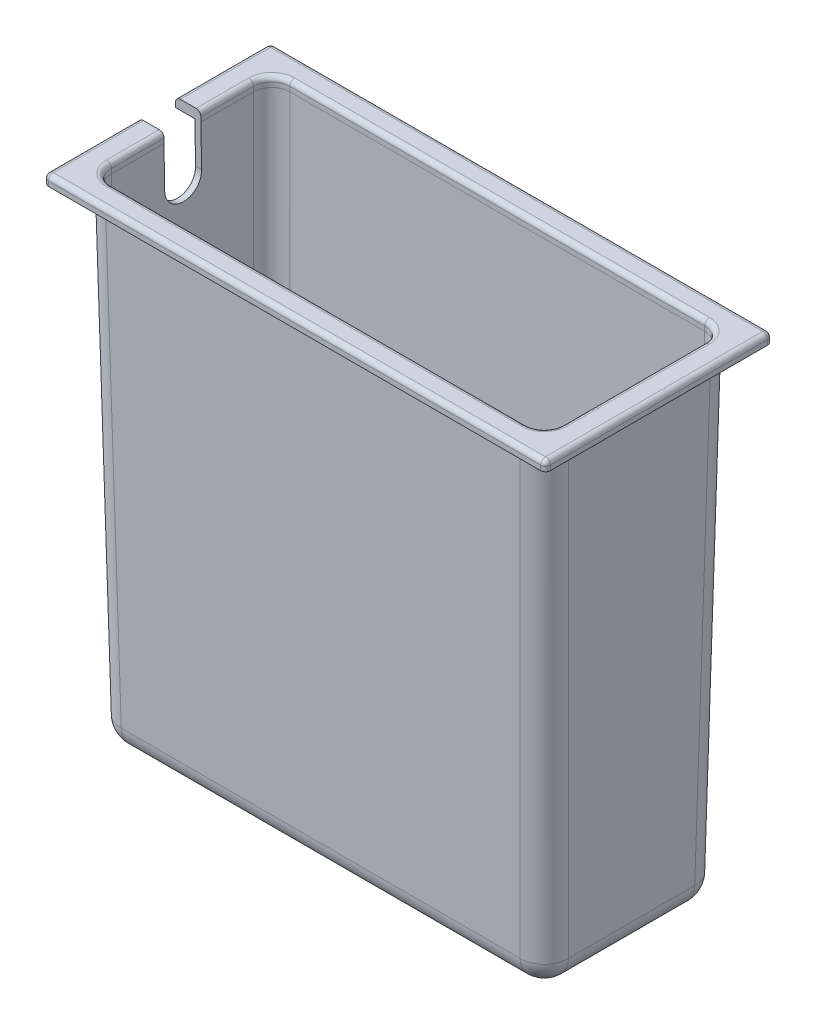
from build123d import *

# Parameters (mm, degrees)
LOFT2_OUTLINE_W     = 185
LOFT2_OUTLINE_H     = 72
LOFT2_DEPTH         = 200
LOFT2_DRAFT         = -1.0025738
FILLET1_R           = 10
SHELL1_T            = -2.5
SKETCH5_W           = 208
SKETCH5_H           = 94
BOSS_EXTRUDE2_DEPTH = 4
CUT_EXTRUDE1_DEPTH  = 231.271578793
CUT_EXTRUDE2_DEPTH  = 234.754144348
FILLET2_R           = 2


# Read off the part's stored shape, not the designer's step: Loft2
with BuildPart() as part:
    # Loft2 outline → Loft2 (with draft: the straight prism first)
    with BuildSketch(Plane(origin=(0, 0, 0), x_dir=(1, 0, 0), z_dir=(0, 1, 0))):
        Rectangle(LOFT2_OUTLINE_W, LOFT2_OUTLINE_H)
    extrude(amount=LOFT2_DEPTH)
    # Loft2: the draft: its side faces are tilted about the plane it starts from
    loft2_sides = [part.faces().sort_by_distance(p)[0] for p in [
        (0, 100, -36),
        (-92.5, 100, 0),
        (0, 100, 36),
        (92.5, 100, 0),
    ]]
    draft(loft2_sides, Plane(origin=(0, 0, 0), x_dir=(1, 0, 0), z_dir=(0, 1, 0)), LOFT2_DRAFT)

    # Fillet1
    fillet1_edges = [part.edges().sort_by_distance(p)[0] for p in [
        (92.5, 0, 0),
        (0, 0, -36),
        (-92.5, 0, 0),
        (0, 0, 36),
        (-94.249999993, 100, -37.749999993),
        (94.249999993, 100, -37.749999993),
        (-94.249999993, 100, 37.749999993),
        (94.249999993, 100, 37.749999993),
    ]]
    fillet(fillet1_edges, radius=FILLET1_R)

    # Shell1
    shell1_openings = [part.faces().sort_by_distance(p)[0] for p in [
        (0, 200, 0),
    ]]
    offset(amount=SHELL1_T, openings=shell1_openings, kind=Kind.INTERSECTION)

    # Sketch5 → Boss-Extrude2 (add)
    with BuildSketch(Plane(origin=(0, 200, 0), x_dir=(1, 0, 0), z_dir=(0, 1, 0))):
        Rectangle(SKETCH5_W, SKETCH5_H)
    extrude(amount=BOSS_EXTRUDE2_DEPTH)

    # Sketch6 → Cut-Extrude1 (cut, through all)
    with BuildSketch(Plane(origin=(0, 200, 0), x_dir=(1, 0, 0), z_dir=(0, 1, 0))):
        with BuildLine():
            Line((85.999617217, -36.999617217), (-85.999617217, -36.999617217))
            ThreePointArc((-85.999617217, -36.999617217), (-91.302918076, -34.802918076), (-93.499617217, -29.499617217))
            Line((-93.499617217, -29.499617217), (-93.499617217, 29.499617217))
            ThreePointArc((-93.499617217, 29.499617217), (-91.302918076, 34.802918076), (-85.999617217, 36.999617217))
            Line((-85.999617217, 36.999617217), (85.999617217, 36.999617217))
            ThreePointArc((85.999617217, 36.999617217), (91.302918076, 34.802918076), (93.499617217, 29.499617217))
            Line((93.499617217, 29.499617217), (93.499617217, -29.499617217))
            ThreePointArc((93.499617217, -29.499617217), (91.302918076, -34.802918076), (85.999617217, -36.999617217))
        make_face()
    extrude(amount=CUT_EXTRUDE1_DEPTH, mode=Mode.SUBTRACT)

    # Sketch3 → Cut-Extrude2 (cut, through all)
    with BuildSketch(Plane(origin=(0, 0, 0), x_dir=(0, 0, -1), z_dir=(1, 0, 0))):
        with BuildLine():
            Line((-7.65, 204), (-7.65, 183.15))
            ThreePointArc((-7.65, 183.15), (0, 175.5), (7.65, 183.15))
            Line((7.65, 183.15), (7.65, 204))
            Line((7.65, 204), (-7.65, 204))
        make_face()
    extrude(amount=-CUT_EXTRUDE2_DEPTH, mode=Mode.SUBTRACT)

    # Fillet2
    fillet2_edges = [part.edges().sort_by_distance(p)[0] for p in [
        (-93.499617217, 204, 18.574808608),
        (-91.302918076, 204, 34.802918076),
        (0, 204, 36.999617217),
        (91.302918076, 204, 34.802918076),
        (93.499617217, 204, 0),
        (91.302918076, 204, -34.802918076),
        (0, 204, -36.999617217),
        (-91.302918076, 204, -34.802918076),
        (-104, 204, -27.325),
        (0, 204, -47),
        (104, 204, 0),
        (-104, 204, 27.325),
        (0, 204, 47),
        (-93.499617217, 204, -18.574808608),
        (-104, 202, -47),
        (-104, 202, 47),
        (104, 202, -47),
        (104, 202, 47),
    ]]
    fillet(fillet2_edges, radius=FILLET2_R)


solid = part.part
